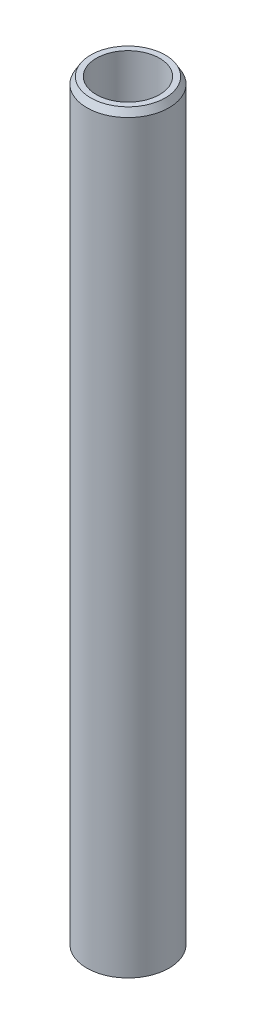
from build123d import *
from OCP.BRepFilletAPI import BRepFilletAPI_MakeChamfer

# Parameters (mm, degrees)
SKETCH1_R           = 17.5
BOSS_EXTRUDE1_DEPTH = 321.885524198
SKETCH2_R           = 13.456387436
CUT_EXTRUDE1_DEPTH  = 323.835547436
CHAMFER1_SIZE       = 2.817738577
CHAMFER1_SIZE2      = 1.626822126


with BuildPart() as part:
    # Sketch1 → Boss-Extrude1 (new body)
    with BuildSketch(Plane(origin=(0, 0, 0), x_dir=(1, 0, 0), z_dir=(0, 1, 0))):
        Circle(SKETCH1_R)
    extrude(amount=BOSS_EXTRUDE1_DEPTH)

    # Sketch2 → Cut-Extrude1 (cut, through all)
    with BuildSketch(Plane(origin=(0, 0, 0), x_dir=(1, 0, 0), z_dir=(0, 1, 0))):
        Circle(SKETCH2_R)
    extrude(amount=CUT_EXTRUDE1_DEPTH, mode=Mode.SUBTRACT)

    # Chamfer1: one chamfer whose edges measure the first distance from different faces: ONE call of the kernel's chamfer builder (chamfer() names one face for all edges)
    chamfer1_edges_1 = [part.edges().sort_by_distance(p)[0] for p in [
        (-17.5, 321.885524198, 0),
    ]]
    chamfer1_side_1 = [part.faces().sort_by_distance(p)[0] for p in [
        (-17.5, 160.942762099, 0),
    ]]
    chamfer1_edges_2 = [part.edges().sort_by_distance(p)[0] for p in [
        (-17.5, 0, 0),
    ]]
    chamfer1_side_2 = [part.faces().sort_by_distance(p)[0] for p in [
        (-17.005025253, 0, 0),
    ]]
    chamfer1 = BRepFilletAPI_MakeChamfer(part.part.solid().wrapped)
    for e in chamfer1_edges_1:
        chamfer1.Add(CHAMFER1_SIZE, CHAMFER1_SIZE2, e.wrapped, chamfer1_side_1[0].wrapped)  # the first distance lies on this face
    for e in chamfer1_edges_2:
        chamfer1.Add(CHAMFER1_SIZE, CHAMFER1_SIZE2, e.wrapped, chamfer1_side_2[0].wrapped)  # the first distance lies on this face
    add(Compound.cast(chamfer1.Shape()), mode=Mode.REPLACE)


solid = part.part
